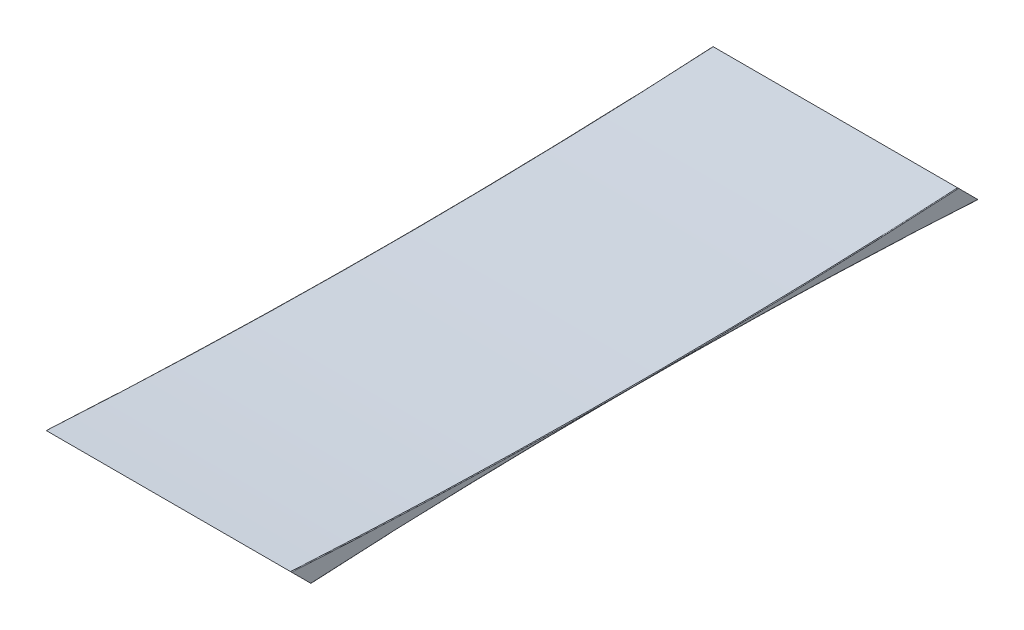
from build123d import *

# Parameters (mm, degrees)
SKETCH1_W           = 2
SKETCH1_H           = 5.6
BOSS_EXTRUDE1_DEPTH = 0.087
CUT_EXTRUDE1_DEPTH  = 4.442029779
CUT_EXTRUDE2_DEPTH  = 4.442029779
FILLET1_R           = 0.005


with BuildPart() as part:
    # Sketch1 → Boss-Extrude1 (new, symmetric)
    with BuildSketch(Plane(origin=(0, 0, 0), x_dir=(1, 0, 0), z_dir=(0, 1, 0))):
        Rectangle(SKETCH1_W, SKETCH1_H)
    extrude(amount=BOSS_EXTRUDE1_DEPTH, both=True)

    # Sketch3 → Cut-Extrude1 (cut, through all)
    with BuildSketch(Plane.ZY.offset(1)):
        with BuildLine():
            Line((-2.8, 0.087), (2.8, 0.087))
            ThreePointArc((2.8, 0.087), (0, 0.005), (-2.8, 0.087))
        make_face()
        with BuildLine():
            Line((-2.8, -0.087), (2.8, -0.087))
            ThreePointArc((2.8, -0.087), (0, -0.005), (-2.8, -0.087))
        make_face()
    extrude(amount=-CUT_EXTRUDE1_DEPTH, mode=Mode.SUBTRACT)

    # Sketch4 → Cut-Extrude2 (cut, through all)
    with BuildSketch(Plane.ZY.offset(1)):
        Polygon((2.8, 0.087), (2.626, -0.087), (2.8, -0.087), align=None)
        Polygon((-2.8, -0.087), (-2.626, 0.087), (-2.8, 0.087), align=None)
    extrude(amount=-CUT_EXTRUDE2_DEPTH, mode=Mode.SUBTRACT)

    # Fillet1
    fillet1_edges = [part.edges().sort_by_distance(p)[0] for p in [
        (-1, 0.00507104, 0.082449888),
        (1, 0.00507104, 0.082449888),
        (-1, -0.00507104, -0.082449888),
        (1, -0.00507104, -0.082449888),
    ]]
    fillet(fillet1_edges, radius=FILLET1_R - 0.0001)  # a hair under: the kernel refuses the full size


solid = part.part
